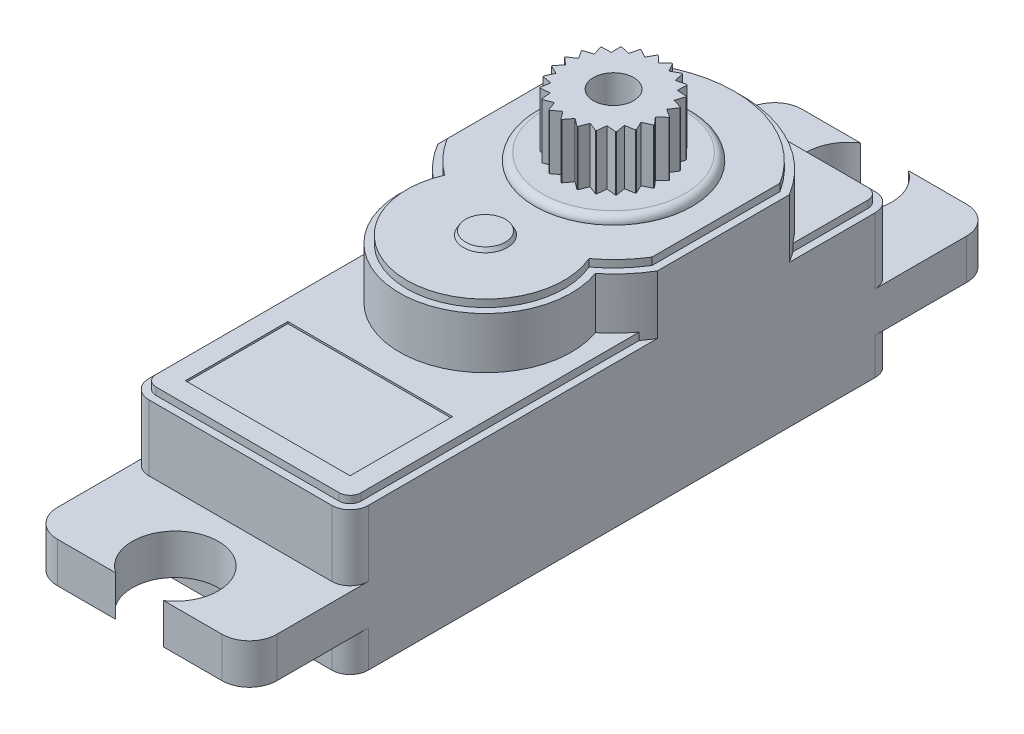
from build123d import *

# Parameters (mm, degrees)
SKETCH2_W            = 12
SKETCH2_H            = 29.7
BOSS_EXTRUDE1_DEPTH  = 7.8
SKETCH3_W            = 12
SKETCH3_H            = 2.2
BOSS_EXTRUDE2_DEPTH  = 5.5
CUT_EXTRUDE1_REACH   = 23.628
SKETCH4_R            = 2.35
FILLET1_R            = 1.5
FILLET1_OF_MIRROR1_R = 1.5
FILLET2_R            = 1
BOSS_EXTRUDE3_DEPTH  = 3.2
BOSS_EXTRUDE4_DEPTH  = 0.4
BOSS_EXTRUDE7_DEPTH  = 0.4
SKETCH8_R            = 1.2
BOSS_EXTRUDE6_DEPTH  = 0.2
BOSS_EXTRUDE6_TAPER  = 30
SKETCH7_R            = 2.85
BOSS_EXTRUDE5_DEPTH  = 3.4
SKETCH9_W            = 9
SKETCH9_H            = 5.6
CUT_EXTRUDE2_DEPTH   = 0.1
SKETCH10_R           = 1.1
CUT_EXTRUDE3_DEPTH   = 3
SKETCH13_R           = 4.3
BOSS_EXTRUDE8_DEPTH  = 0.4
FILLET3_R            = 0.4
CUT_EXTRUDE4_DEPTH   = 25.276789326
CIRPATTERN1_COUNT    = 23


with BuildPart() as part:
    # Sketch2 → Boss-Extrude1 (new body)
    with BuildSketch(Plane(origin=(0, 0, 0), x_dir=(1, 0, 0), z_dir=(0, 1, 0))):
        Rectangle(SKETCH2_W, SKETCH2_H)
    extrude(amount=BOSS_EXTRUDE1_DEPTH)

    # Sketch3 → Boss-Extrude2 (add)
    with BuildSketch(Plane.XY.offset(14.85)):
        with Locations((0, 3.1)):
            Rectangle(SKETCH3_W, SKETCH3_H)
    boss_extrude2 = extrude(amount=BOSS_EXTRUDE2_DEPTH)

    # Sketch4 → Cut-Extrude1 (cut, up to next)
    with BuildSketch(Plane(origin=(0, 4.2, 0), x_dir=(1, 0, 0), z_dir=(0, 1, 0)), mode=Mode.PRIVATE) as cut_extrude1_sk1:
        with Locations((0, -18.4)):
            Circle(SKETCH4_R)
    cut_extrude1_tool1 = extrude(cut_extrude1_sk1.sketch, amount=-CUT_EXTRUDE1_REACH, mode=Mode.PRIVATE) & part.part
    cut_extrude1 = cut_extrude1_tool1.solids().sort_by_distance((0, 4.2, 18.4))[0]
    add(cut_extrude1, mode=Mode.SUBTRACT)

    # Fillet1
    fillet1_edges = [part.edges().sort_by_distance(p)[0] for p in [
        (6, 3.1, 20.35),
        (-6, 3.1, 20.35),
    ]]
    fillet(fillet1_edges, radius=FILLET1_R)

    # Mirror1: Boss-Extrude2, Cut-Extrude1 across plane
    add(boss_extrude2.mirror(Plane.XY))
    add(cut_extrude1.mirror(Plane.XY), mode=Mode.SUBTRACT)

    # Fillet1 of Mirror1
    fillet1_of_mirror1_edges = [part.edges().sort_by_distance(p)[0] for p in [
        (6, 3.1, -20.35),
        (-6, 3.1, -20.35),
    ]]
    fillet(fillet1_of_mirror1_edges, radius=FILLET1_OF_MIRROR1_R)

    # Fillet2
    fillet2_edges = [part.edges().sort_by_distance(p)[0] for p in [
        (6, 1, 14.85),
        (6, 6, 14.85),
        (-6, 1, 14.85),
        (-6, 6, 14.85),
        (6, 1, -14.85),
        (6, 6, -14.85),
        (-6, 6, -14.85),
        (-6, 1, -14.85),
    ]]
    fillet(fillet2_edges, radius=FILLET2_R)

    # Sketch5 → Boss-Extrude3 (add)
    with BuildSketch(Plane(origin=(0, 7.8, 0), x_dir=(1, 0, 0), z_dir=(0, 1, 0))):
        with BuildLine():
            Line((-6, 9.155551275), (-6, 1.944448725))
            ThreePointArc((-6, 1.944448725), (-5.292143556, 0.968164496), (-4.427230154, 0.127857143))
            ThreePointArc((-4.427230154, 0.127857143), (0, -6.15), (4.427230154, 0.127857143))
            ThreePointArc((4.427230154, 0.127857143), (5.292143556, 0.968164496), (6, 1.944448725))
            Line((6, 1.944448725), (6, 9.155551275))
            ThreePointArc((6, 9.155551275), (0, 12.55), (-6, 9.155551275))
        make_face()
    extrude(amount=BOSS_EXTRUDE3_DEPTH)

    # Sketch6 → Boss-Extrude4 (add)
    with BuildSketch(Plane(origin=(0, 11, 0), x_dir=(1, 0, 0), z_dir=(0, 1, 0))):
        with BuildLine():
            Line((5.6, 2.057150161), (5.6, 9.042849839))
            ThreePointArc((5.6, 9.042849839), (0, 12.15), (-5.6, 9.042849839))
            Line((-5.6, 9.042849839), (-5.6, 2.057150161))
            ThreePointArc((-5.6, 2.057150161), (-4.856753194, 1.081001408), (-3.945673877, 0.259285714))
            ThreePointArc((-3.945673877, 0.259285714), (0, -5.75), (3.945673877, 0.259285714))
            ThreePointArc((3.945673877, 0.259285714), (4.856753194, 1.081001408), (5.6, 2.057150161))
        make_face()
    extrude(amount=BOSS_EXTRUDE4_DEPTH)

    # Sketch11 → Boss-Extrude7 (add)
    with BuildSketch(Plane(origin=(0, 7.8, 0), x_dir=(1, 0, 0), z_dir=(0, 1, 0))):
        with BuildLine():
            Line((-5.6, 13.85), (-5.6, -13.85))
            ThreePointArc((-5.6, -13.85), (-5.424264069, -14.274264069), (-5, -14.45))
            Line((-5, -14.45), (5, -14.45))
            ThreePointArc((5, -14.45), (5.424264069, -14.274264069), (5.6, -13.85))
            Line((5.6, -13.85), (5.6, 13.85))
            ThreePointArc((5.6, 13.85), (5.424264069, 14.274264069), (5, 14.45))
            Line((5, 14.45), (-5, 14.45))
            ThreePointArc((-5, 14.45), (-5.424264069, 14.274264069), (-5.6, 13.85))
        make_face()
    extrude(amount=BOSS_EXTRUDE7_DEPTH)

    # Sketch8 → Boss-Extrude6 (add)
    with BuildSketch(Plane(origin=(0, 11.4, 0), x_dir=(1, 0, 0), z_dir=(0, 1, 0))):
        with Locations((0, -1.45)):
            Circle(SKETCH8_R)
    extrude(amount=BOSS_EXTRUDE6_DEPTH, taper=BOSS_EXTRUDE6_TAPER)

    # Sketch7 → Boss-Extrude5 (add)
    with BuildSketch(Plane(origin=(0, 11.4, 0), x_dir=(1, 0, 0), z_dir=(0, 1, 0))):
        with Locations(Location((0, 5.55, 0), (0, 0, 270))):
            Circle(SKETCH7_R)
    extrude(amount=BOSS_EXTRUDE5_DEPTH)

    # Sketch9 → Cut-Extrude2 (cut)
    with BuildSketch(Plane(origin=(0, 8.2, 0), x_dir=(1, 0, 0), z_dir=(0, 1, 0))):
        with Locations((0, -10.55)):
            Rectangle(SKETCH9_W, SKETCH9_H)
    extrude(amount=-CUT_EXTRUDE2_DEPTH, mode=Mode.SUBTRACT)

    # Sketch10 → Cut-Extrude3 (cut)
    with BuildSketch(Plane(origin=(0, 14.8, 0), x_dir=(1, 0, 0), z_dir=(0, 1, 0))):
        with Locations(Location((0, 5.55, 0), (0, 0, 270))):
            Circle(SKETCH10_R)
    extrude(amount=-CUT_EXTRUDE3_DEPTH, mode=Mode.SUBTRACT)

    # Sketch13 → Boss-Extrude8 (add)
    with BuildSketch(Plane(origin=(0, 11.4, 0), x_dir=(1, 0, 0), z_dir=(0, 1, 0))):
        with Locations(Location((0, 5.55, 0), (0, 0, 270))):
            Circle(SKETCH13_R)
    extrude(amount=BOSS_EXTRUDE8_DEPTH)

    # Fillet3
    fillet3_edges = [part.edges().sort_by_distance(p)[0] for p in [
        (0, 11.8, -9.85),
    ]]
    fillet(fillet3_edges, radius=FILLET3_R - 0.0001)  # a hair under: the kernel refuses the full size

    # Sketch12 → Cut-Extrude4 (cut, through all)
    with BuildSketch(Plane(origin=(0, 11.8, 0), x_dir=(1, 0, 0), z_dir=(0, 1, 0))):
        Polygon((0, 8.010177118), (-0.466249863, 8.476426981), (0.466249863, 8.476426981), align=None)
    cut_extrude4 = extrude(amount=CUT_EXTRUDE4_DEPTH, mode=Mode.SUBTRACT)

    # CirPattern1: Cut-Extrude4 ×23 about axis
    cirpattern1_axis = Axis((0, 0, -5.55), (0, 1, 0))
    for i in range(1, CIRPATTERN1_COUNT):
        add(cut_extrude4.rotate(cirpattern1_axis, i * 360 / CIRPATTERN1_COUNT), mode=Mode.SUBTRACT)


solid = part.part
